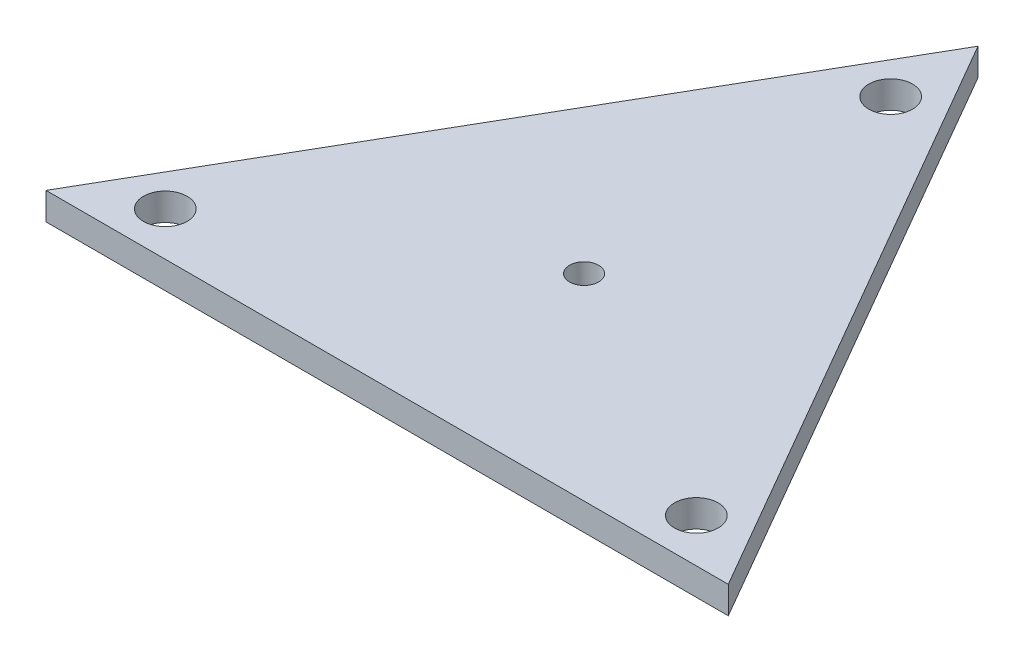
from build123d import *

# Parameters (mm, degrees)
BOSS_EXTRUDE1_DEPTH     = 5
CUT_EXTRUDE1_DEPTH      = 126.099960032
CUT_EXTRUDE1_DEPTH_BACK = 126.099960032
SKETCH2_R               = 4
SKETCH2_R_2             = 2.665209895


with BuildPart() as part:
    # Sketch1 → Boss-Extrude1 (new body)
    with BuildSketch(Plane(origin=(0, 0, 0), x_dir=(1, 0, 0), z_dir=(0, 1, 0))):
        Polygon((0, 108.253175473), (62.5, 0), (-62.5, 0), align=None)
    extrude(amount=BOSS_EXTRUDE1_DEPTH)

    # Sketch2 → Cut-Extrude1 (cut, two sides: drawn at the far end of the back side and taken through both)
    with BuildSketch(Plane(origin=(0, 5, 0), x_dir=(1, 0, 0), z_dir=(0, 1, 0)).offset(-CUT_EXTRUDE1_DEPTH_BACK)):
        with Locations((-48.643593539, 8)):
            Circle(SKETCH2_R)
        with Locations((48.643593539, 8)):
            Circle(SKETCH2_R)
        with Locations((0, 92.253175473)):
            Circle(SKETCH2_R)
        with Locations((0, 36.084391824)):
            Circle(SKETCH2_R_2)
    extrude(amount=CUT_EXTRUDE1_DEPTH + CUT_EXTRUDE1_DEPTH_BACK, mode=Mode.SUBTRACT)


solid = part.part
